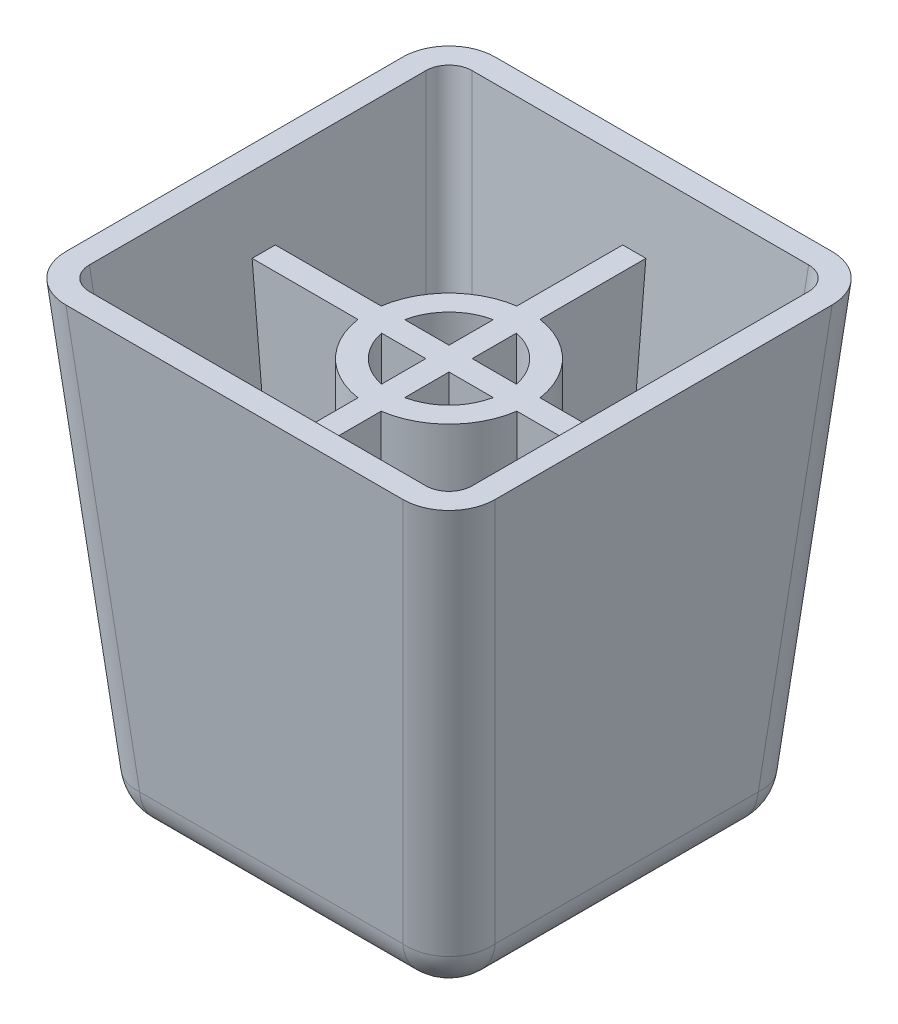
from build123d import *

# Parameters (mm, degrees)
SKETCH1_W          = 75
SKETCH1_H          = 75
BASE_EXTRUDE_DEPTH = 100
BASE_EXTRUDE_DRAFT = -5
FILLET1_R          = 10
SHELL1_T           = -5
RIB1_START         = -2.5
RIB1_DEPTH         = 5
RIB1_START_2       = -36.248793674
RIB1_2_OUTLINE_W   = 80
RIB1_2_OUTLINE_H   = 5
RIB1_2_DEPTH       = 72.497587348
RIB1_START_3       = 5
RIB1_3_DEPTH       = 80
RIB1_START_4       = 43.067212481
RIB1_4_OUTLINE_W   = 3.751206326
RIB1_4_OUTLINE_H   = 5
RIB1_4_DEPTH       = 41.932787519


with BuildPart() as part:
    # Sketch1 → Base-Extrude (with draft: the straight prism first)
    with BuildSketch(Plane(origin=(0, 0, 0), x_dir=(1, 0, 0), z_dir=(0, 1, 0))):
        Rectangle(SKETCH1_W, SKETCH1_H)
    extrude(amount=BASE_EXTRUDE_DEPTH)
    # Base-Extrude: the draft: its side faces are tilted about the plane it starts from
    base_extrude_sides = [part.faces().sort_by_distance(p)[0] for p in [
        (0, 50, -37.5),
        (-37.5, 50, 0),
        (0, 50, 37.5),
        (37.5, 50, 0),
    ]]
    draft(base_extrude_sides, Plane(origin=(0, 0, 0), x_dir=(1, 0, 0), z_dir=(0, 1, 0)), BASE_EXTRUDE_DRAFT)

    # Fillet1
    fillet1_edges = [part.edges().sort_by_distance(p)[0] for p in [
        (0, 0, 37.5),
        (-37.5, 0, 0),
        (0, 0, -37.5),
        (37.5, 0, 0),
        (41.874433176, 50, 41.874433176),
        (-41.874433176, 50, 41.874433176),
        (-41.874433176, 50, -41.874433176),
        (41.874433176, 50, -41.874433176),
    ]]
    fillet(fillet1_edges, radius=FILLET1_R)

    # Shell1
    shell1_openings = [part.faces().sort_by_distance(p)[0] for p in [
        (0, 100, 0),
    ]]
    offset(amount=SHELL1_T, openings=shell1_openings, kind=Kind.INTERSECTION)

    # Rib1: read off the stored shape, not the designer's step
    # Rib1 outline → Rib1 (add)
    with BuildSketch(Plane.YZ.offset(RIB1_START)):
        with BuildLine():
            Line((85, 39.917437212), (9.564221286, 33.31766175))
            ThreePointArc((9.564221286, 33.31766175), (6.313613316, 31.714639298), (5, 28.33668826))
            Line((5, 28.33668826), (5, -28.33668826))
            ThreePointArc((5, -28.33668826), (6.313613316, -31.714639298), (9.564221286, -33.31766175))
            Line((9.564221286, -33.31766175), (85, -39.917437212))
            Line((85, -39.917437212), (85, 39.917437212))
        make_face()
    extrude(amount=RIB1_DEPTH)

    # Rib1 2 outline → Rib1 2 (add)
    with BuildSketch(Plane.YZ.offset(RIB1_START_2)):
        with Locations((45, 0)):
            Rectangle(RIB1_2_OUTLINE_W, RIB1_2_OUTLINE_H)
    extrude(amount=RIB1_2_DEPTH)

    # Rib1 3 outline → Rib1 3 (add)
    with BuildSketch(Plane(origin=(0, 0, 0), x_dir=(1, 0, 0), z_dir=(0, 1, 0)).offset(RIB1_START_3)):
        with BuildLine():
            ThreePointArc((-2.5, -12.038877834), (-8.694382655, -8.694382655), (-12.038877834, -2.5))
            Line((-12.038877834, -2.5), (-17.11407953, -2.5))
            ThreePointArc((-17.11407953, -2.5), (-12.229916561, -12.229916561), (-2.5, -17.11407953))
            Line((-2.5, -17.11407953), (-2.5, -12.038877834))
        make_face()
        with BuildLine():
            ThreePointArc((2.5, -17.11407953), (12.229916561, -12.229916561), (17.11407953, -2.5))
            Line((17.11407953, -2.5), (12.038877834, -2.5))
            ThreePointArc((12.038877834, -2.5), (8.694382655, -8.694382655), (2.5, -12.038877834))
            Line((2.5, -12.038877834), (2.5, -17.11407953))
        make_face()
        with BuildLine():
            Line((-17.11407953, 2.5), (-12.038877834, 2.5))
            ThreePointArc((-12.038877834, 2.5), (-8.694382655, 8.694382655), (-2.5, 12.038877834))
            Line((-2.5, 12.038877834), (-2.5, 17.11407953))
            ThreePointArc((-2.5, 17.11407953), (-12.229916561, 12.229916561), (-17.11407953, 2.5))
        make_face()
        with BuildLine():
            ThreePointArc((17.11407953, 2.5), (12.229916561, 12.229916561), (2.5, 17.11407953))
            Line((2.5, 17.11407953), (2.5, 12.038877834))
            ThreePointArc((2.5, 12.038877834), (8.694382655, 8.694382655), (12.038877834, 2.5))
            Line((12.038877834, 2.5), (17.11407953, 2.5))
        make_face()
    extrude(amount=RIB1_3_DEPTH)

    # Rib1 4 outline → Rib1 4 (add)
    with BuildSketch(Plane(origin=(0, 0, 0), x_dir=(1, 0, 0), z_dir=(0, 1, 0)).offset(RIB1_START_4)):
        with Locations((-38.124396837, 0)):
            Rectangle(RIB1_4_OUTLINE_W, RIB1_4_OUTLINE_H)
        with Locations((38.124396837, 0)):
            Rectangle(RIB1_4_OUTLINE_W, RIB1_4_OUTLINE_H)
    extrude(amount=RIB1_4_DEPTH)


solid = part.part
